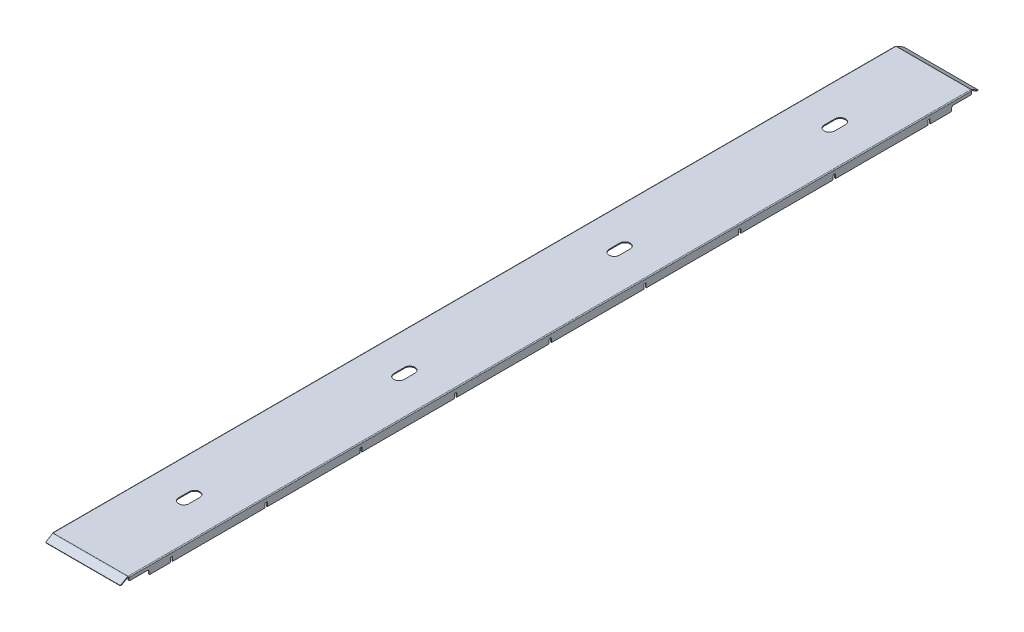
from build123d import *

# Parameters (mm, degrees)
SKIZZE9_W                       = 178
SKIZZE9_H                       = 1958
BASIS_BLECH2_DEPTH              = 2
KANTE_LASCHE3_STRIP_W           = 8.2
KANTE_LASCHE3_STRIP_H           = 2
KANTE_LASCHE3_STRIP_CUT_DEPTH   = 1958
KANTE_LASCHE3_STRIP_2_W         = 8.2
KANTE_LASCHE3_STRIP_2_H         = 2
KANTE_LASCHE3_STRIP_CUT_2_DEPTH = 1958
KANTE_LASCHE3_DEPTH             = 1958
KANTE_LASCHE3_FLAT_DEPTH        = 2
KANTE_LASCHE3_BEND_DEPTH        = 1958
KANTE_LASCHE3_FLAT_2_DEPTH      = 2
KANTE_LASCHE4_DEPTH             = 173.8
KANTE_LASCHE4_BEND_DEPTH        = 173.8
M6_GEWINDEBOHRUNG1_D            = 5
M6_GEWINDEBOHRUNG1_DEPTH        = 17
M6_GEWINDEBOHRUNG1_TIP          = 1.502151548
SCHNITT_LINEAR_AUSTRAGEN1_DEPTH = 10
VERRUNDUNG1_R                   = 2


# Sheet-metal steps are written as plain solids
with BuildPart() as part:
    # Skizze9 → Basis-Blech2 (new body)
    with BuildSketch(Plane(origin=(0, 0, 0), x_dir=(1, 0, 0), z_dir=(0, 1, 0))):
        Rectangle(SKIZZE9_W, SKIZZE9_H)
    extrude(amount=-BASIS_BLECH2_DEPTH)

    # Kante-Lasche3 strip (across the edge) → Kante-Lasche3 strip cut (cut)
    with BuildSketch(Plane(origin=(-89, -2, 979), x_dir=(1, 0, 0), z_dir=(0, 0, -1))):
        with Locations((-2, -1)):
            Rectangle(KANTE_LASCHE3_STRIP_W, KANTE_LASCHE3_STRIP_H)
    extrude(amount=KANTE_LASCHE3_STRIP_CUT_DEPTH, mode=Mode.SUBTRACT)

    # Kante-Lasche3 strip 2 (across the edge) → Kante-Lasche3 strip cut 2 (cut)
    with BuildSketch(Plane(origin=(89, -2, -979), x_dir=(-1, 0, 0), z_dir=(0, 0, 1))):
        with Locations((-2, -1)):
            Rectangle(KANTE_LASCHE3_STRIP_2_W, KANTE_LASCHE3_STRIP_2_H)
    extrude(amount=KANTE_LASCHE3_STRIP_CUT_2_DEPTH, mode=Mode.SUBTRACT)

    # Kante-Lasche3 bend section (across the edge) → Kante-Lasche3 (add)
    with BuildSketch(Plane(origin=(-89, -2, 979), x_dir=(1, 0, 0), z_dir=(0, 0, -1))):
        with BuildLine():
            Line((0, 0.1), (2, 0.1))
            ThreePointArc((2, 0.1), (2.029289322, 0.029289322), (2.1, 0))
            Line((2.1, 0), (2.1, -2))
            ThreePointArc((2.1, -2), (0.61507576, -1.38492424), (0, 0.1))
        make_face()
    extrude(amount=KANTE_LASCHE3_DEPTH)

    # Kante-Lasche3 profile (on flange) → Kante-Lasche3 flat (add)
    with BuildSketch(Plane(origin=(-89, -2, 0), x_dir=(0, 0, -1), z_dir=(-1, 0, 0))):
        with BuildLine():
            Line((979, 0.1), (979, 7))
            Line((979, 7), (937, 7))
            ThreePointArc((937, 7), (933.464466094, 8.464466094), (932, 12))
            Line((932, 12), (932, 18))
            Line((932, 18), (882.7, 18))
            Line((882.7, 18), (882.7, 10))
            ThreePointArc((882.7, 10), (880, 7.3), (877.3, 10))
            Line((877.3, 10), (877.3, 18))
            Line((877.3, 18), (662.7, 18))
            Line((662.7, 18), (662.7, 10))
            ThreePointArc((662.7, 10), (660, 7.3), (657.3, 10))
            Line((657.3, 10), (657.3, 18))
            Line((657.3, 18), (442.7, 18))
            Line((442.7, 18), (442.7, 10))
            ThreePointArc((442.7, 10), (440, 7.3), (437.3, 10))
            Line((437.3, 10), (437.3, 18))
            Line((437.3, 18), (222.7, 18))
            Line((222.7, 18), (222.7, 10))
            ThreePointArc((222.7, 10), (220, 7.3), (217.3, 10))
            Line((217.3, 10), (217.3, 18))
            Line((217.3, 18), (2.7, 18))
            Line((2.7, 18), (2.7, 10))
            ThreePointArc((2.7, 10), (0, 7.3), (-2.7, 10))
            Line((-2.7, 10), (-2.7, 18))
            Line((-2.7, 18), (-217.3, 18))
            Line((-217.3, 18), (-217.3, 10))
            ThreePointArc((-217.3, 10), (-220, 7.3), (-222.7, 10))
            Line((-222.7, 10), (-222.7, 18))
            Line((-222.7, 18), (-437.3, 18))
            Line((-437.3, 18), (-437.3, 10))
            ThreePointArc((-437.3, 10), (-440, 7.3), (-442.7, 10))
            Line((-442.7, 10), (-442.7, 18))
            Line((-442.7, 18), (-657.3, 18))
            Line((-657.3, 18), (-657.3, 10))
            ThreePointArc((-657.3, 10), (-660, 7.3), (-662.7, 10))
            Line((-662.7, 10), (-662.7, 18))
            Line((-662.7, 18), (-877.3, 18))
            Line((-877.3, 18), (-877.3, 10))
            ThreePointArc((-877.3, 10), (-880, 7.3), (-882.7, 10))
            Line((-882.7, 10), (-882.7, 18))
            Line((-882.7, 18), (-932, 18))
            Line((-932, 18), (-932, 12))
            ThreePointArc((-932, 12), (-933.464466094, 8.464466094), (-937, 7))
            Line((-937, 7), (-979, 7))
            Line((-979, 7), (-979, 0.1))
            Line((-979, 0.1), (979, 0.1))
        make_face()
    extrude(amount=-KANTE_LASCHE3_FLAT_DEPTH)

    # Kante-Lasche3 bend section 2 (across the edge) → Kante-Lasche3 bend (add)
    with BuildSketch(Plane(origin=(89, -2, -979), x_dir=(-1, 0, 0), z_dir=(0, 0, 1))):
        with BuildLine():
            Line((0, 0.1), (2, 0.1))
            ThreePointArc((2, 0.1), (2.029289322, 0.029289322), (2.1, 0))
            Line((2.1, 0), (2.1, -2))
            ThreePointArc((2.1, -2), (0.61507576, -1.38492424), (0, 0.1))
        make_face()
    extrude(amount=KANTE_LASCHE3_BEND_DEPTH)

    # Kante-Lasche3 profile 2 (on flange) → Kante-Lasche3 flat 2 (add)
    with BuildSketch(Plane(origin=(89, -2, 0), x_dir=(0, 0, 1), z_dir=(1, 0, 0))):
        with BuildLine():
            Line((979, 0.1), (979, 7))
            Line((979, 7), (937, 7))
            ThreePointArc((937, 7), (933.464466094, 8.464466094), (932, 12))
            Line((932, 12), (932, 18))
            Line((932, 18), (882.7, 18))
            Line((882.7, 18), (882.7, 10))
            ThreePointArc((882.7, 10), (880, 7.3), (877.3, 10))
            Line((877.3, 10), (877.3, 18))
            Line((877.3, 18), (662.7, 18))
            Line((662.7, 18), (662.7, 10))
            ThreePointArc((662.7, 10), (660, 7.3), (657.3, 10))
            Line((657.3, 10), (657.3, 18))
            Line((657.3, 18), (442.7, 18))
            Line((442.7, 18), (442.7, 10))
            ThreePointArc((442.7, 10), (440, 7.3), (437.3, 10))
            Line((437.3, 10), (437.3, 18))
            Line((437.3, 18), (222.7, 18))
            Line((222.7, 18), (222.7, 10))
            ThreePointArc((222.7, 10), (220, 7.3), (217.3, 10))
            Line((217.3, 10), (217.3, 18))
            Line((217.3, 18), (2.7, 18))
            Line((2.7, 18), (2.7, 10))
            ThreePointArc((2.7, 10), (0, 7.3), (-2.7, 10))
            Line((-2.7, 10), (-2.7, 18))
            Line((-2.7, 18), (-217.3, 18))
            Line((-217.3, 18), (-217.3, 10))
            ThreePointArc((-217.3, 10), (-220, 7.3), (-222.7, 10))
            Line((-222.7, 10), (-222.7, 18))
            Line((-222.7, 18), (-437.3, 18))
            Line((-437.3, 18), (-437.3, 10))
            ThreePointArc((-437.3, 10), (-440, 7.3), (-442.7, 10))
            Line((-442.7, 10), (-442.7, 18))
            Line((-442.7, 18), (-657.3, 18))
            Line((-657.3, 18), (-657.3, 10))
            ThreePointArc((-657.3, 10), (-660, 7.3), (-662.7, 10))
            Line((-662.7, 10), (-662.7, 18))
            Line((-662.7, 18), (-877.3, 18))
            Line((-877.3, 18), (-877.3, 10))
            ThreePointArc((-877.3, 10), (-880, 7.3), (-882.7, 10))
            Line((-882.7, 10), (-882.7, 18))
            Line((-882.7, 18), (-932, 18))
            Line((-932, 18), (-932, 12))
            ThreePointArc((-932, 12), (-933.464466094, 8.464466094), (-937, 7))
            Line((-937, 7), (-979, 7))
            Line((-979, 7), (-979, 0.1))
            Line((-979, 0.1), (979, 0.1))
        make_face()
    extrude(amount=-KANTE_LASCHE3_FLAT_2_DEPTH)

    # Kante-Lasche4 section (across the edge) → Kante-Lasche4 (add)
    with BuildSketch(Plane(origin=(86.9, -2, 979.026794919), x_dir=(0, -0.8660254037844416, -0.49999999999999495), z_dir=(-1, 0, 0))):
        with BuildLine():
            Line((-2, 0.026794919), (-2, 19.464101615))
            Line((-2, 19.464101615), (0, 19.464101615))
            Line((0, 19.464101615), (0, 0.026794919))
            ThreePointArc((0, 0.026794919), (0.003407417, 0.000913015), (0.01339746, -0.023205081))
            Line((0.01339746, -0.023205081), (-1.718653348, -1.023205081))
            ThreePointArc((-1.718653348, -1.023205081), (-1.928444235, -0.516725075), (-2, 0.026794919))
        make_face()
    extrude(amount=KANTE_LASCHE4_DEPTH)

    # Kante-Lasche4 section 2 (across the edge) → Kante-Lasche4 bend (add)
    with BuildSketch(Plane(origin=(-86.9, -2, -979.026794919), x_dir=(0, -0.8660254037844416, 0.49999999999999495), z_dir=(1, 0, 0))):
        with BuildLine():
            Line((-2, 0.026794919), (-2, 19.464101615))
            Line((-2, 19.464101615), (0, 19.464101615))
            Line((0, 19.464101615), (0, 0.026794919))
            ThreePointArc((0, 0.026794919), (0.003407417, 0.000913015), (0.01339746, -0.023205081))
            Line((0.01339746, -0.023205081), (-1.718653348, -1.023205081))
            ThreePointArc((-1.718653348, -1.023205081), (-1.928444235, -0.516725075), (-2, 0.026794919))
        make_face()
    extrude(amount=KANTE_LASCHE4_BEND_DEPTH)

    # M6 Gewindebohrung1
    with Locations(Plane.ZY.offset(89)):
        with Locations((-550, -12), (550, -12)):
            Hole(M6_GEWINDEBOHRUNG1_D / 2, depth=M6_GEWINDEBOHRUNG1_DEPTH)
            with Locations((0, 0, -(M6_GEWINDEBOHRUNG1_DEPTH + M6_GEWINDEBOHRUNG1_TIP / 2))):  # 118° drill point
                Cone(0, M6_GEWINDEBOHRUNG1_D / 2, M6_GEWINDEBOHRUNG1_TIP, mode=Mode.SUBTRACT)

    # Skizze81 → Schnitt-Linear austragen1 (cut)
    with BuildSketch(Plane(origin=(0, 0, 0), x_dir=(1, 0, 0), z_dir=(0, 1, 0))):
        with BuildLine():
            Line((12, -737.5), (12, -762.5))
            ThreePointArc((12, -762.5), (0, -774.5), (-12, -762.5))
            Line((-12, -762.5), (-12, -737.5))
            ThreePointArc((-12, -737.5), (0, -725.5), (12, -737.5))
        make_face()
        with BuildLine():
            Line((12, -237.5), (12, -262.5))
            ThreePointArc((12, -262.5), (0, -274.5), (-12, -262.5))
            Line((-12, -262.5), (-12, -237.5))
            ThreePointArc((-12, -237.5), (0, -225.5), (12, -237.5))
        make_face()
        with BuildLine():
            Line((12, 262.5), (12, 237.5))
            ThreePointArc((12, 237.5), (0, 225.5), (-12, 237.5))
            Line((-12, 237.5), (-12, 262.5))
            ThreePointArc((-12, 262.5), (0, 274.5), (12, 262.5))
        make_face()
        with BuildLine():
            Line((12, 762.5), (12, 737.5))
            ThreePointArc((12, 737.5), (0, 725.5), (-12, 737.5))
            Line((-12, 737.5), (-12, 762.5))
            ThreePointArc((-12, 762.5), (0, 774.5), (12, 762.5))
        make_face()
    extrude(amount=-SCHNITT_LINEAR_AUSTRAGEN1_DEPTH, mode=Mode.SUBTRACT)

    # Verrundung1
    verrundung1_edges = [part.edges().sort_by_distance(p)[0] for p in [
        (88, -9, -979),
        (88, -9, 979),
        (88, -20, 932),
        (88, -20, -932),
        (86.9, -10.866025404, 996.38320138),
        (-86.9, -10.866025404, 996.38320138),
        (-86.9, -10.866025404, -996.38320138),
        (86.9, -10.866025404, -996.38320138),
        (-88, -9, 979),
        (-88, -9, -979),
        (-88, -20, -932),
        (-88, -20, 932),
    ]]
    fillet(verrundung1_edges, radius=VERRUNDUNG1_R)


solid = part.part
